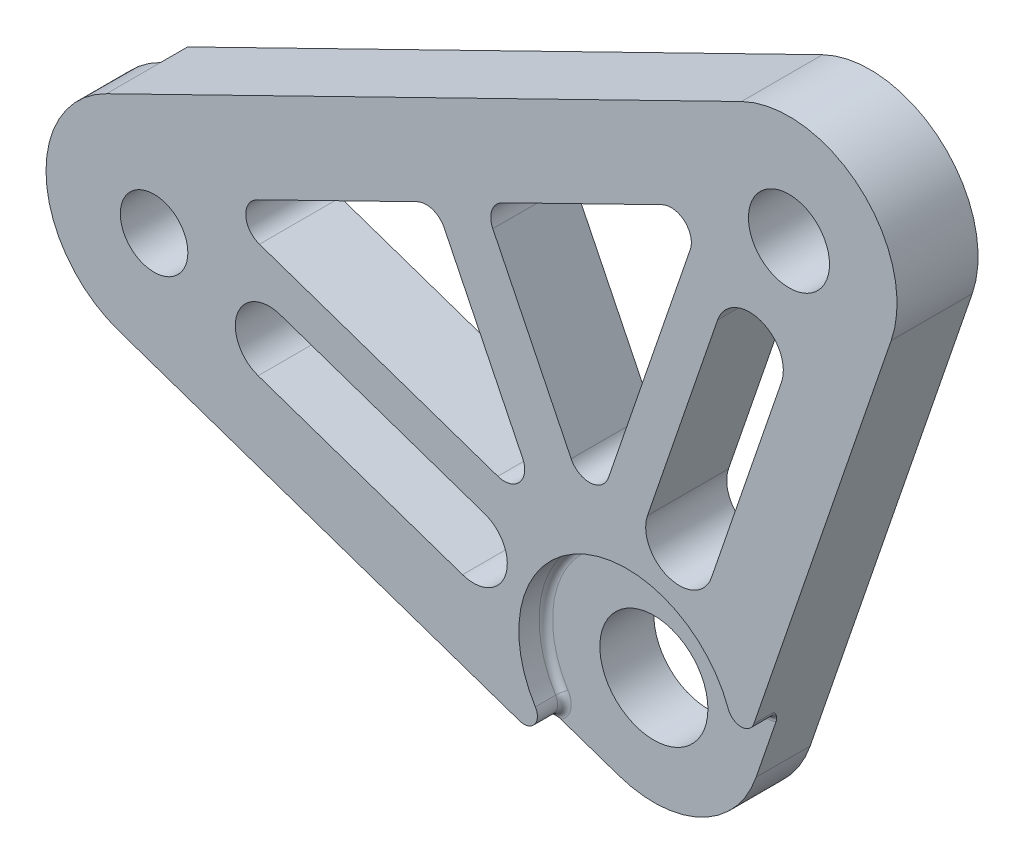
from build123d import *

# Parameters (mm, degrees)
SKETCH1_R               = 2.5
SKETCH1_R_2             = 4
SKETCH1_R_3             = 3
BOSS_EXTRUDE1_DEPTH     = 6
CUT_EXTRUDE1_DEPTH      = 62.10646447
CUT_EXTRUDE1_DEPTH_BACK = 62.10646447
CUT_EXTRUDE2_START      = -2
SKETCH4_R               = 8
CUT_EXTRUDE2_DEPTH      = 2
FILLET1_START           = 4
FILLET1_DEPTH           = 2
FILLET2_R               = 0.5
CUT_EXTRUDE3_DEPTH      = 2


with BuildPart() as part:
    # Sketch1 → Boss-Extrude1 (new body)
    with BuildSketch(Plane.XY):
        with BuildLine():
            Line((19.567567568, 32.405405405), (7.567567568, -2.594594595))
            ThreePointArc((7.567567568, -2.594594595), (3.516422912, -7.185733776), (-2.594594595, -7.567567568))
            Line((-2.594594595, -7.567567568), (-37.594594595, 4.432432432))
            ThreePointArc((-37.594594595, 4.432432432), (-42.984429152, 11.50111011), (-38.516422912, 19.185733776))
            Line((-38.516422912, 19.185733776), (8.483577088, 42.185733776))
            ThreePointArc((8.483577088, 42.185733776), (17.293075573, 40.998612422), (19.567567568, 32.405405405))
        make_face()
        with Locations((-35, 12)):
            Circle(SKETCH1_R, mode=Mode.SUBTRACT)
        Circle(SKETCH1_R_2, mode=Mode.SUBTRACT)
        with Locations((12, 35)):
            Circle(SKETCH1_R_3, mode=Mode.SUBTRACT)
    extrude(amount=BOSS_EXTRUDE1_DEPTH)

    # Sketch2 → Cut-Extrude1 (cut, two sides: drawn at the far end of the back side and taken through both)
    with BuildSketch(Plane.XY.offset(6).offset(-CUT_EXTRUDE1_DEPTH_BACK)):
        with BuildLine():
            Line((-27.3724879, 17.959246424), (-15.522864255, 23.75799842))
            ThreePointArc((-15.522864255, 23.75799842), (-14.377048473, 23.829592256), (-13.516209876, 23.070002633))
            Line((-13.516209876, 23.070002633), (-7.71745788, 11.220378988))
            ThreePointArc((-7.71745788, 11.220378988), (-7.940043134, 9.568598022), (-9.551269449, 9.142130773))
            Line((-9.551269449, 9.142130773), (-27.199645091, 15.193002422))
            ThreePointArc((-27.199645091, 15.193002422), (-28.21023907, 16.518379486), (-27.3724879, 17.959246424))
        make_face()
        with BuildLine():
            Line((-25.675675676, 11.445945946), (-10.540540541, 6.256756757))
            ThreePointArc((-10.540540541, 6.256756757), (-8.986486486, 3.081081081), (-12.162162162, 1.527027027))
            Line((-12.162162162, 1.527027027), (-27.297297297, 6.716216216))
            ThreePointArc((-27.297297297, 6.716216216), (-28.851351351, 9.891891892), (-25.675675676, 11.445945946))
        make_face()
        with BuildLine():
            Line((-9.923342988, 24.828214089), (-4.124590991, 12.978590444))
            ThreePointArc((-4.124590991, 12.978590444), (-2.683724054, 12.140839274), (-1.358346989, 13.151433254))
            Line((-1.358346989, 13.151433254), (4.692524659, 30.799808895))
            ThreePointArc((4.692524659, 30.799808895), (4.26605741, 32.41103521), (2.614276444, 32.633620464))
            Line((2.614276444, 32.633620464), (-9.235347201, 26.834868468))
            ThreePointArc((-9.235347201, 26.834868468), (-9.994936824, 25.974029871), (-9.923342988, 24.828214089))
        make_face()
        with BuildLine():
            Line((6.716216216, 27.297297297), (1.527027027, 12.162162162))
            ThreePointArc((1.527027027, 12.162162162), (3.081081081, 8.986486486), (6.256756757, 10.540540541))
            Line((6.256756757, 10.540540541), (11.445945946, 25.675675676))
            ThreePointArc((11.445945946, 25.675675676), (9.891891892, 28.851351351), (6.716216216, 27.297297297))
        make_face()
    extrude(amount=CUT_EXTRUDE1_DEPTH + CUT_EXTRUDE1_DEPTH_BACK, mode=Mode.SUBTRACT)

    # Sketch4 → Cut-Extrude2 (cut)
    with BuildSketch(Plane.XY.offset(6).offset(CUT_EXTRUDE2_START)):
        Circle(SKETCH4_R)
    extrude(amount=CUT_EXTRUDE2_DEPTH, mode=Mode.SUBTRACT)

    # Fillet1: read off the stored shape, not the designer's step
    # Fillet1 outline → Fillet1 (cut)
    with BuildSketch(Plane.XY.offset(FILLET1_START)):
        with BuildLine():
            ThreePointArc((9.402223, 2.75648375), (8.465816464, 2.080853575), (7.516690715, 2.738496066))
            ThreePointArc((7.516690715, 2.738496066), (7.999635991, 0.076315279), (7.567567568, -2.594594595))
            Line((7.567567568, -2.594594595), (9.402223, 2.75648375))
        make_face()
        with BuildLine():
            ThreePointArc((-2.594594595, -7.567567568), (-4.968729766, -6.269906261), (-6.774532102, -4.255081057))
            ThreePointArc((-6.774532102, -4.255081057), (-6.837610332, -5.40805741), (-7.945672939, -5.732912135))
            Line((-7.945672939, -5.732912135), (-2.594594595, -7.567567568))
        make_face()
    extrude(amount=FILLET1_DEPTH, mode=Mode.SUBTRACT)

    # Fillet2
    fillet2_edges = [part.edges().sort_by_distance(p)[0] for p in [
        (-3.516422912, 7.185733776, 4),
        (8.465816464, 2.080853575, 4),
        (-6.837610332, -5.40805741, 4),
    ]]
    fillet(fillet2_edges, radius=FILLET2_R)

    # Sketch5 → Cut-Extrude3 (cut)
    with BuildSketch(Plane(origin=(0, 0, 0), x_dir=(-1, 0, 0), z_dir=(0, 0, -1))):
        with BuildLine():
            Line((37.594594595, 4.432432432), (32.321369427, 7.778040946))
            ThreePointArc((32.321369427, 7.778040946), (30.00973178, 12.311806181), (32.86775168, 16.522556479))
            Line((32.86775168, 16.522556479), (38.516422912, 19.185733776))
            ThreePointArc((38.516422912, 19.185733776), (42.984429152, 11.50111011), (37.594594595, 4.432432432))
        make_face()
    extrude(amount=-CUT_EXTRUDE3_DEPTH, mode=Mode.SUBTRACT)


solid = part.part
